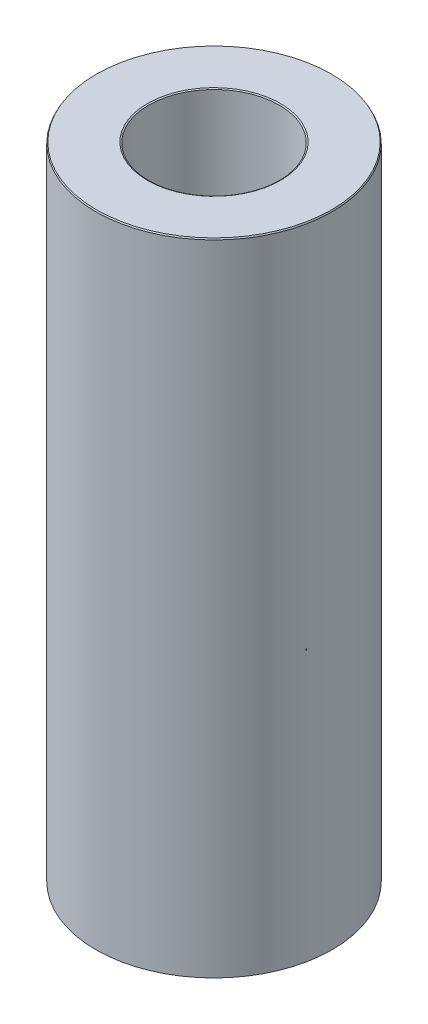
from build123d import *
from OCP.BRepFilletAPI import BRepFilletAPI_MakeChamfer

# Parameters (mm, degrees)
SKETCH1_R           = 60
BOSS_EXTRUDE1_DEPTH = 325.263457723
SKETCH2_R           = 33.136287913
CUT_EXTRUDE1_DEPTH  = 337.149247998
CHAMFER1_SIZE       = 0.645472734
CHAMFER1_SIZE2      = 0.372663857


with BuildPart() as part:
    # Sketch1 → Boss-Extrude1 (new body)
    with BuildSketch(Plane(origin=(0, 0, 0), x_dir=(1, 0, 0), z_dir=(0, 1, 0))):
        Circle(SKETCH1_R)
    extrude(amount=BOSS_EXTRUDE1_DEPTH)

    # Sketch2 → Cut-Extrude1 (cut, through all)
    with BuildSketch(Plane(origin=(0, 0, 0), x_dir=(1, 0, 0), z_dir=(0, 1, 0))):
        Circle(SKETCH2_R)
    extrude(amount=CUT_EXTRUDE1_DEPTH, mode=Mode.SUBTRACT)

    # Chamfer1: one chamfer whose edges measure the first distance from different faces: ONE call of the kernel's chamfer builder (chamfer() names one face for all edges)
    chamfer1_edges_1 = [part.edges().sort_by_distance(p)[0] for p in [
        (-33.136287913, 325.263457723, 0),
    ]]
    chamfer1_side_1 = [part.faces().sort_by_distance(p)[0] for p in [
        (-58.302943725, 325.263457723, 0),
    ]]
    chamfer1_edges_2 = [part.edges().sort_by_distance(p)[0] for p in [
        (-33.136287913, 0, 0),
    ]]
    chamfer1_side_2 = [part.faces().sort_by_distance(p)[0] for p in [
        (-33.136287913, 162.631728862, 0),
    ]]
    chamfer1_edges_3 = [part.edges().sort_by_distance(p)[0] for p in [
        (-60, 0, 0),
    ]]
    chamfer1_side_3 = [part.faces().sort_by_distance(p)[0] for p in [
        (-58.302943725, 0, 0),
    ]]
    chamfer1_edges_4 = [part.edges().sort_by_distance(p)[0] for p in [
        (-60, 325.263457723, 0),
    ]]
    chamfer1_side_4 = [part.faces().sort_by_distance(p)[0] for p in [
        (-60, 162.631728862, 0),
    ]]
    chamfer1 = BRepFilletAPI_MakeChamfer(part.part.solid().wrapped)
    for e in chamfer1_edges_1:
        chamfer1.Add(CHAMFER1_SIZE, CHAMFER1_SIZE2, e.wrapped, chamfer1_side_1[0].wrapped)  # the first distance lies on this face
    for e in chamfer1_edges_2:
        chamfer1.Add(CHAMFER1_SIZE, CHAMFER1_SIZE2, e.wrapped, chamfer1_side_2[0].wrapped)  # the first distance lies on this face
    for e in chamfer1_edges_3:
        chamfer1.Add(CHAMFER1_SIZE, CHAMFER1_SIZE2, e.wrapped, chamfer1_side_3[0].wrapped)  # the first distance lies on this face
    for e in chamfer1_edges_4:
        chamfer1.Add(CHAMFER1_SIZE, CHAMFER1_SIZE2, e.wrapped, chamfer1_side_4[0].wrapped)  # the first distance lies on this face
    add(Compound.cast(chamfer1.Shape()), mode=Mode.REPLACE)


solid = part.part
